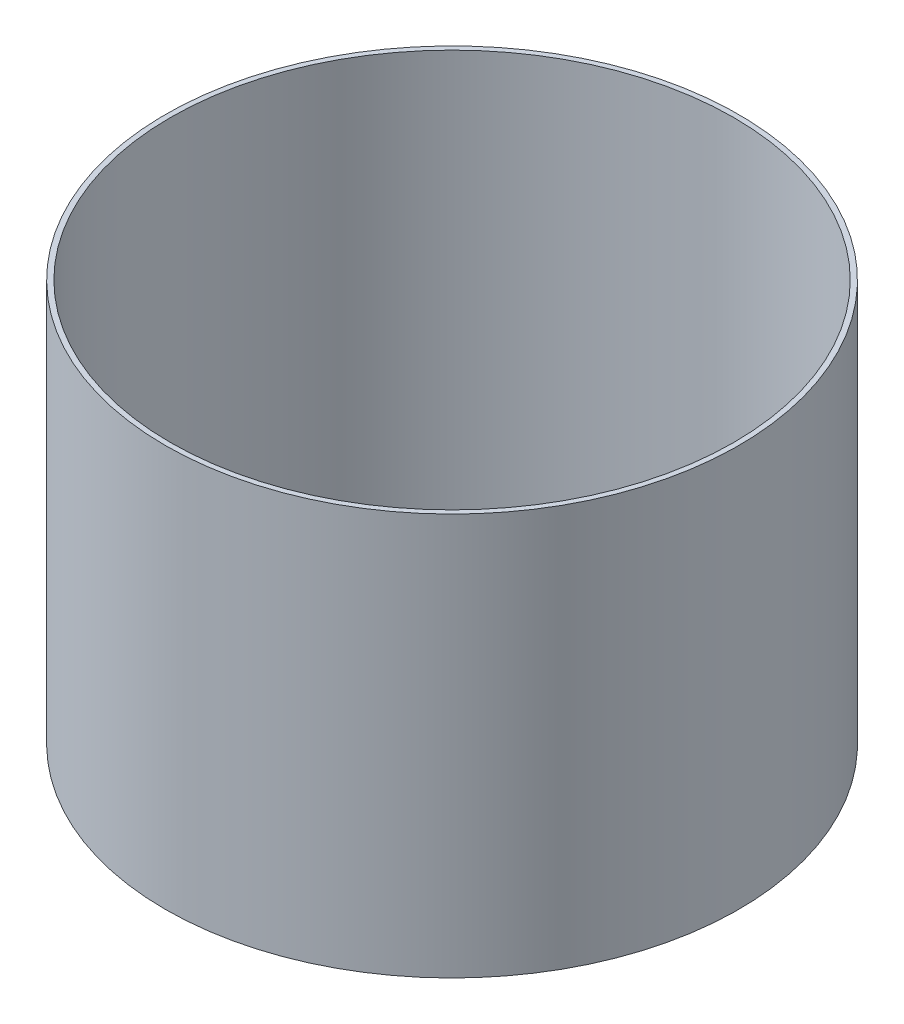
from build123d import *

# Parameters (mm, degrees)
SKETCH2_R      = 71.12
SKETCH2_R_2    = 69.85
EXTRUDE1_DEPTH = 99.6696


with BuildPart() as part:
    # Sketch2 → Extrude1 (new body)
    with BuildSketch(Plane(origin=(0, 0, 0), x_dir=(1, 0, 0), z_dir=(0, 1, 0))):
        Circle(SKETCH2_R)
        Circle(SKETCH2_R_2, mode=Mode.SUBTRACT)
    extrude(amount=-EXTRUDE1_DEPTH)


solid = part.part
